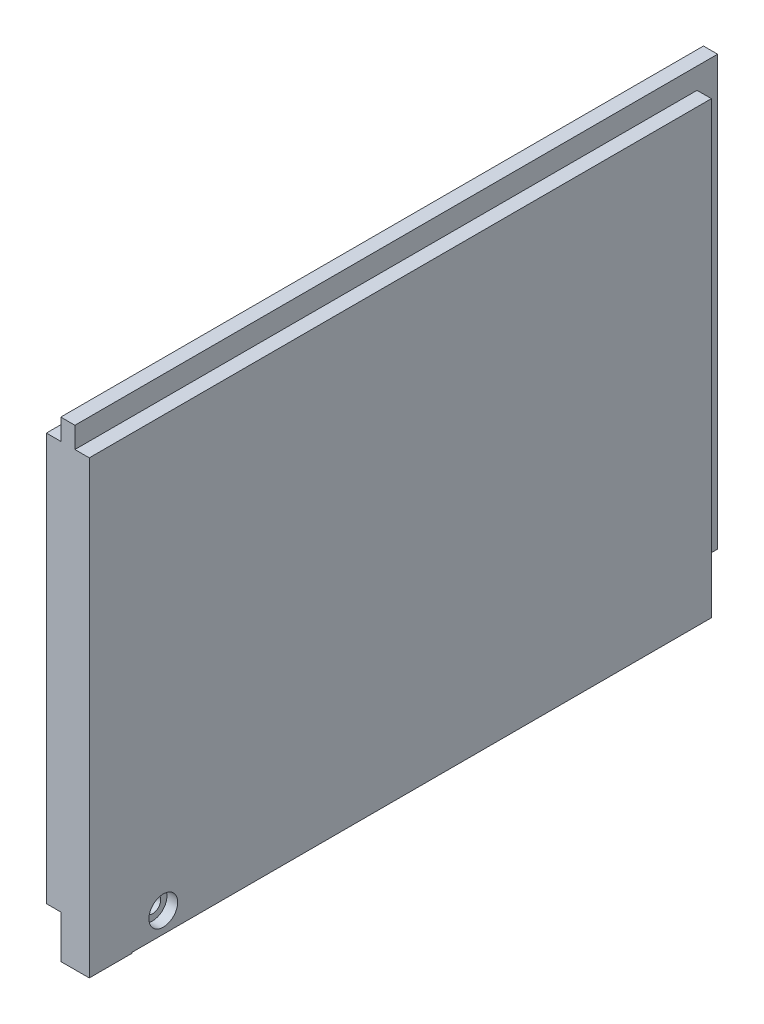
from build123d import *
from OCP.BRepFilletAPI import BRepFilletAPI_MakeChamfer

# Parameters (mm, degrees)
SKETCH2_W           = 95
SKETCH2_H           = 145
BOSS_EXTRUDE1_DEPTH = 10
SKETCH3_W           = 3.3
SKETCH3_H           = 4.8
BOSS_EXTRUDE3_DEPTH = 95
SKETCH4_W           = 3.3
SKETCH4_H           = 149.8
BOSS_EXTRUDE4_DEPTH = 4.9
BOSS_EXTRUDE5_DEPTH = 10
CUT_EXTRUDE1_REACH  = 178.366
SKETCH6_R           = 1.9
SKETCH8_R           = 3.35
CUT_EXTRUDE3_DEPTH  = 2.5
CUT_EXTRUDE2_REACH  = 178.366
SKETCH7_W           = 0.2
SKETCH7_H           = 135
SKETCH9_W           = 85
SKETCH9_H           = 135
CUT_EXTRUDE4_DEPTH  = 5
CHAMFER1_SIZE       = 2.5
CHAMFER1_SIZE_2     = 5


with BuildPart() as part:
    # Sketch2 → Boss-Extrude1 (new body)
    with BuildSketch(Plane.YZ):
        with Locations((47.5, 72.5)):
            Rectangle(SKETCH2_W, SKETCH2_H)
    extrude(amount=BOSS_EXTRUDE1_DEPTH)

    # Sketch3 → Boss-Extrude3 (add)
    with BuildSketch(Plane(origin=(0, 95, 0), x_dir=(-1, 0, 0), z_dir=(0, 1, 0))):
        with Locations((-5, -2.4)):
            Rectangle(SKETCH3_W, SKETCH3_H)
    extrude(amount=-BOSS_EXTRUDE3_DEPTH)

    # Sketch4 → Boss-Extrude4 (add)
    with BuildSketch(Plane(origin=(0, 95, 0), x_dir=(-1, 0, 0), z_dir=(0, 1, 0))):
        with Locations((-5, 70.1)):
            Rectangle(SKETCH4_W, SKETCH4_H)
    extrude(amount=BOSS_EXTRUDE4_DEPTH)

    # Sketch5 → Boss-Extrude5 (add)
    with BuildSketch(Plane.XZ):
        Polygon((10, 145), (3.35, 145), (3.35, 0), (6.65, 0), (10, 0), align=None)
    extrude(amount=BOSS_EXTRUDE5_DEPTH)

    # Sketch6 → Cut-Extrude1 (cut, up to next)
    with BuildSketch(Plane.YZ.offset(10), mode=Mode.PRIVATE) as cut_extrude1_sk1:
        with Locations(Location((-5, 127.75, 0), (0, 0, 270))):
            Circle(SKETCH6_R)
    cut_extrude1_tool1 = extrude(cut_extrude1_sk1.sketch, amount=-CUT_EXTRUDE1_REACH, mode=Mode.PRIVATE) & part.part
    add(cut_extrude1_tool1.solids().sort_by_distance((10, -5, 127.75))[0], mode=Mode.SUBTRACT)

    # Sketch8 → Cut-Extrude3 (cut)
    with BuildSketch(Plane.YZ.offset(10)):
        with Locations(Location((-5, 127.75, 0), (0, 0, 270))):
            Circle(SKETCH8_R)
    extrude(amount=-CUT_EXTRUDE3_DEPTH, mode=Mode.SUBTRACT)

    # Sketch7 → Cut-Extrude2 (cut, up to next)
    with BuildSketch(Plane.YZ.offset(10), mode=Mode.PRIVATE) as cut_extrude2_sk1:
        with Locations((-9.9, 67.5)):
            Rectangle(SKETCH7_W, SKETCH7_H)
    cut_extrude2_tool1 = extrude(cut_extrude2_sk1.sketch, amount=-CUT_EXTRUDE2_REACH, mode=Mode.PRIVATE) & part.part
    add(cut_extrude2_tool1.solids().sort_by_distance((10, -9.9, 67.5))[0], mode=Mode.SUBTRACT)

    # Sketch9 → Cut-Extrude4 (cut)
    with BuildSketch(Plane(origin=(0, 0, 0), x_dir=(0, -1, 0), z_dir=(-1, 0, 0))):
        with Locations((-47.5, 72.5)):
            Rectangle(SKETCH9_W, SKETCH9_H)
    extrude(amount=-CUT_EXTRUDE4_DEPTH, mode=Mode.SUBTRACT)

    # Chamfer1
    chamfer1_edges_1 = [part.edges().sort_by_distance(p)[0] for p in [
        (0, 47.5, 5),
    ]]
    chamfer1_side_1 = [part.faces().sort_by_distance(p)[0] for p in [
        (0, 47.5, 4.95),
    ]]
    chamfer1_edges_2 = [part.edges().sort_by_distance(p)[0] for p in [
        (0, 5, 72.5),
    ]]
    chamfer1_side_2 = [part.faces().sort_by_distance(p)[0] for p in [
        (0, 4.95, 72.5),
    ]]
    chamfer1_edges_3 = [part.edges().sort_by_distance(p)[0] for p in [
        (0, 90, 72.5),
    ]]
    chamfer1_side_3 = [part.faces().sort_by_distance(p)[0] for p in [
        (0, 90.05, 72.5),
    ]]
    chamfer1_edges_4 = [part.edges().sort_by_distance(p)[0] for p in [
        (0, 47.5, 140),
    ]]
    chamfer1_side_4 = [part.faces().sort_by_distance(p)[0] for p in [
        (0, 47.5, 140.05),
    ]]
    chamfer1 = BRepFilletAPI_MakeChamfer(part.part.solid().wrapped)
    for e in chamfer1_edges_1:
        chamfer1.Add(CHAMFER1_SIZE - 0.0001, CHAMFER1_SIZE_2 - 0.0001, e.wrapped, chamfer1_side_1[0].wrapped)
    for e in chamfer1_edges_2:
        chamfer1.Add(CHAMFER1_SIZE - 0.0001, CHAMFER1_SIZE_2 - 0.0001, e.wrapped, chamfer1_side_2[0].wrapped)
    for e in chamfer1_edges_3:
        chamfer1.Add(CHAMFER1_SIZE - 0.0001, CHAMFER1_SIZE_2 - 0.0001, e.wrapped, chamfer1_side_3[0].wrapped)
    for e in chamfer1_edges_4:
        chamfer1.Add(CHAMFER1_SIZE - 0.0001, CHAMFER1_SIZE_2 - 0.0001, e.wrapped, chamfer1_side_4[0].wrapped)
    add(Compound.cast(chamfer1.Shape()), mode=Mode.REPLACE)  # a hair under: the kernel refuses the full size


solid = part.part
